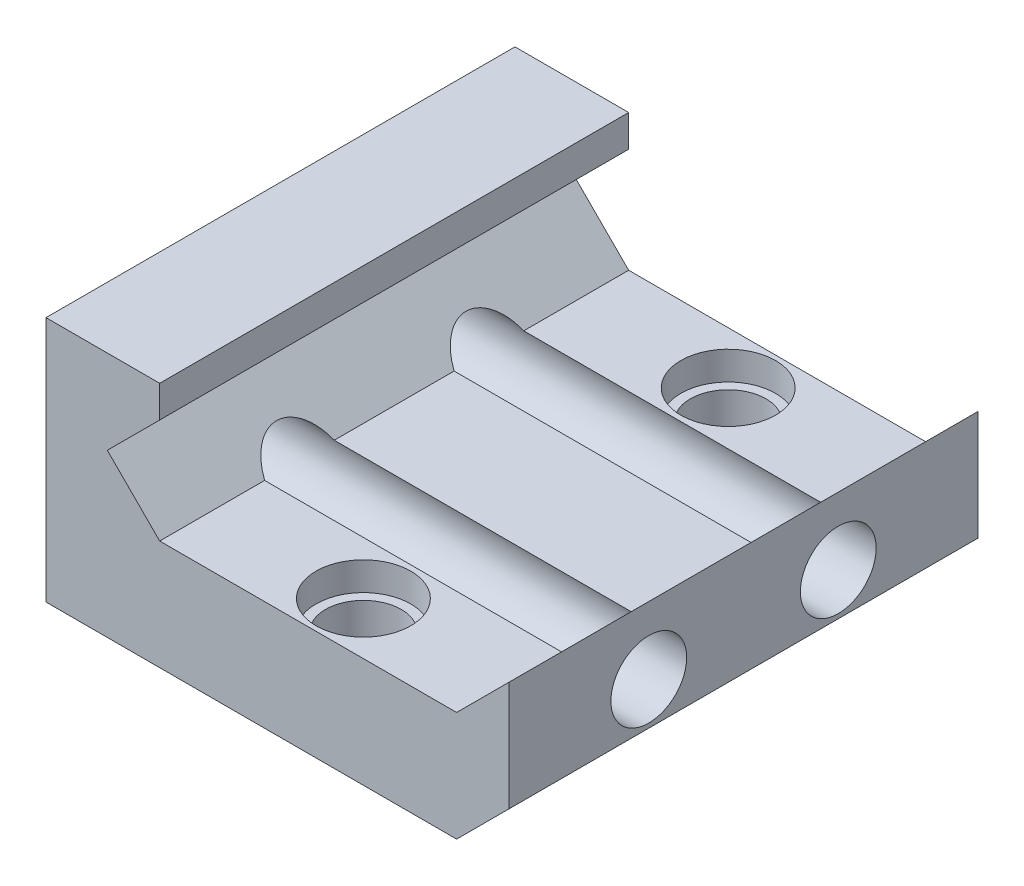
from build123d import *

# Parameters (mm, degrees)
DODANIE_WYCI_GNI_CIE3_DEPTH = 24.75
SZKIC3_R                    = 2
WYTNIJ_WYCI_GNI_CIE1_DEPTH  = 24.75
SZKIC4_R                    = 2
WYTNIJ_WYCI_GNI_CIE2_DEPTH  = 6
SZKIC7_R                    = 2.5
WYTNIJ_WYCI_GNI_CIE3_DEPTH  = 1.5


with BuildPart() as part:
    # Szkic1 → Dodanie-wyciągnięcie3 (new body)
    with BuildSketch(Plane.XY):
        Polygon((-14, 5.461694315), (-8, 5.461694315), (-8, 3.781694315), (-10.765, 1.016694315), (-8, -1.748305685), (7.67, -1.748305685), (10.434999737, 1.016693872), (10.434999737, -4.773306128), (7.67, -7.538305685), (-14, -7.538305685), align=None)
    extrude(amount=DODANIE_WYCI_GNI_CIE3_DEPTH)

    # Szkic3 → Wytnij-wyciągnięcie1 (cut)
    with BuildSketch(Plane(origin=(10.434999737, 0, 0), x_dir=(0, 0, -1), z_dir=(1, 0, 0))):
        with Locations((-17.375, -2.538305685)):
            Circle(SZKIC3_R)
        with Locations((-7.375, -2.538305685)):
            Circle(SZKIC3_R)
    extrude(amount=-WYTNIJ_WYCI_GNI_CIE1_DEPTH, mode=Mode.SUBTRACT)

    # Szkic4 → Wytnij-wyciągnięcie2 (cut)
    with BuildSketch(Plane(origin=(0, -1.748305685, 0), x_dir=(1, 0, 0), z_dir=(0, 1, 0))):
        with Locations((0, -2.75)):
            Circle(SZKIC4_R)
        with Locations((0, -22)):
            Circle(SZKIC4_R)
    extrude(amount=-WYTNIJ_WYCI_GNI_CIE2_DEPTH, mode=Mode.SUBTRACT)

    # Szkic7 → Wytnij-wyciągnięcie3 (cut)
    with BuildSketch(Plane(origin=(0, -1.748305685, 0), x_dir=(1, 0, 0), z_dir=(0, 1, 0))):
        with Locations((0, -2.75)):
            Circle(SZKIC7_R)
        with Locations((0, -22)):
            Circle(SZKIC7_R)
    extrude(amount=-WYTNIJ_WYCI_GNI_CIE3_DEPTH, mode=Mode.SUBTRACT)


solid = part.part
